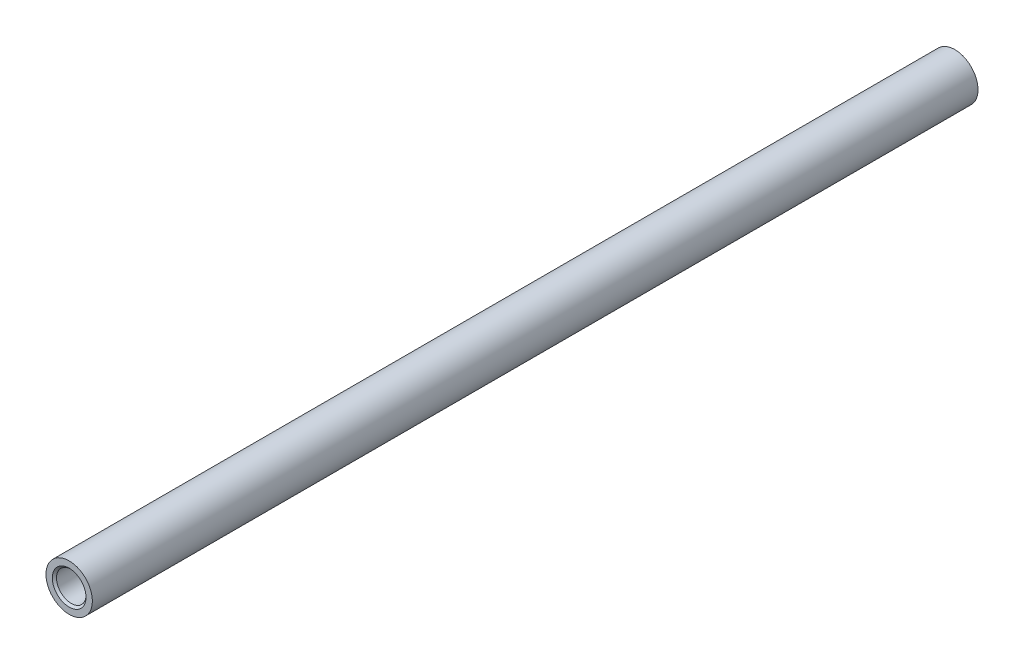
from build123d import *

# Parameters (mm, degrees)
SZKIC1_R                    = 11
SZKIC1_R_2                  = 7
DODANIE_WYCI_GNI_CIE1_DEPTH = 210
SZKIC2_R                    = 8
WYTNIJ_WYCI_GNI_CIE1_DEPTH  = 50
SFAZOWANIE1_SIZE            = 1


with BuildPart() as part:
    # Szkic1 → Dodanie-wyciągnięcie1 (new, symmetric)
    with BuildSketch(Plane.XY):
        Circle(SZKIC1_R)
        Circle(SZKIC1_R_2, mode=Mode.SUBTRACT)
    extrude(amount=DODANIE_WYCI_GNI_CIE1_DEPTH, both=True)

    # Szkic2 → Wytnij-wyciągnięcie1 (cut)
    with BuildSketch(Plane(origin=(0, 0, -210), x_dir=(-1, 0, 0), z_dir=(0, 0, -1))):
        Circle(SZKIC2_R)
    extrude(amount=-WYTNIJ_WYCI_GNI_CIE1_DEPTH, mode=Mode.SUBTRACT)

    # Sfazowanie1
    sfazowanie1_edges = [part.edges().sort_by_distance(p)[0] for p in [
        (-7, 0, 210),
    ]]
    chamfer(sfazowanie1_edges, length=SFAZOWANIE1_SIZE)


solid = part.part
